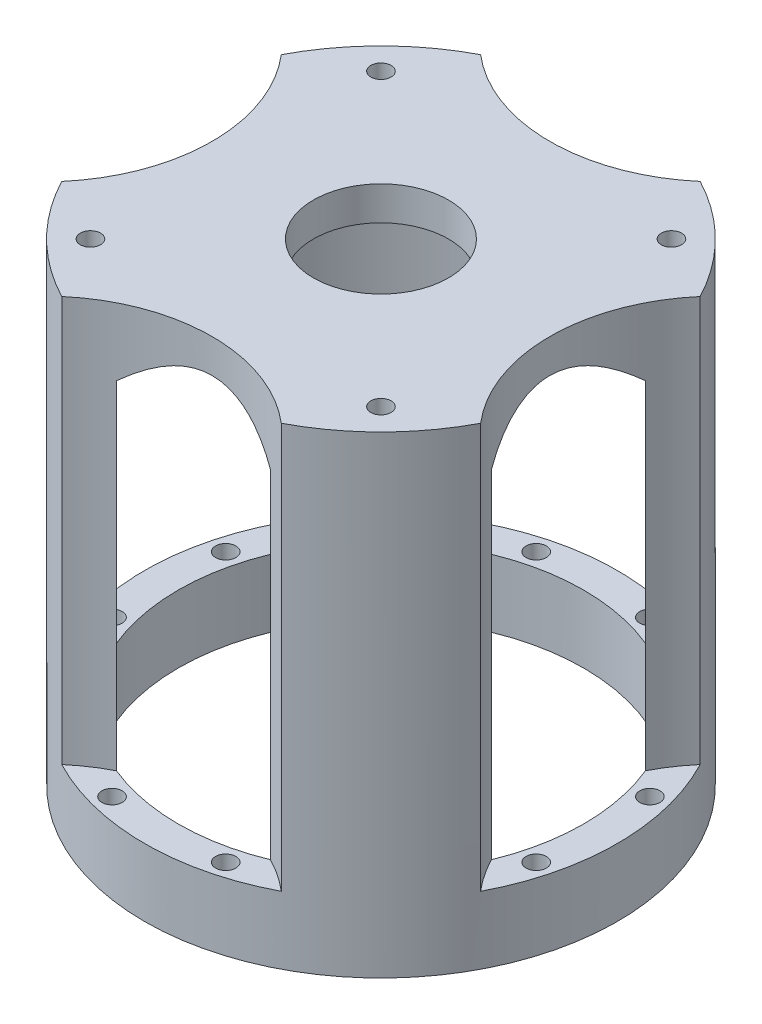
from build123d import *

# Parameters (mm, degrees)
SKETCH1_R           = 35
SKETCH1_R_2         = 30
SKETCH1_R_3         = 1.5
BOSS_EXTRUDE1_DEPTH = 65
SKETCH2_R           = 35
SKETCH2_R_2         = 1.5
SKETCH2_R_3         = 10
BOSS_EXTRUDE2_DEPTH = 5
SKETCH3_R           = 25
CUT_EXTRUDE1_DEPTH  = 60
CIRPATTERN1_COUNT   = 4
CHAMFER1_SIZE       = 5
SKETCH4_R           = 1.5
CUT_EXTRUDE2_DEPTH  = 4


with BuildPart() as part:
    # Sketch1 → Boss-Extrude1 (new body)
    with BuildSketch(Plane(origin=(0, 0, 0), x_dir=(1, 0, 0), z_dir=(0, 1, 0))):
        with Locations(Location((0, 0, 0), (0, 0, 270))):
            Circle(SKETCH1_R)
        with Locations(Location((0, 0, 0), (0, 0, 270))):
            Circle(SKETCH1_R_2, mode=Mode.SUBTRACT)
        with Locations(Location((-8.411618966, 31.392589354, 0), (0, 0, 270))):
            Circle(SKETCH1_R_3, mode=Mode.SUBTRACT)
        with Locations(Location((8.411618966, 31.392589354, 0), (0, 0, 270))):
            Circle(SKETCH1_R_3, mode=Mode.SUBTRACT)
        with Locations(Location((31.392589354, 8.411618966, 0), (0, 0, 270))):
            Circle(SKETCH1_R_3, mode=Mode.SUBTRACT)
        with Locations(Location((31.392589354, -8.411618966, 0), (0, 0, 270))):
            Circle(SKETCH1_R_3, mode=Mode.SUBTRACT)
        with Locations(Location((8.411618966, -31.392589354, 0), (0, 0, 270))):
            Circle(SKETCH1_R_3, mode=Mode.SUBTRACT)
        with Locations(Location((-8.411618966, -31.392589354, 0), (0, 0, 270))):
            Circle(SKETCH1_R_3, mode=Mode.SUBTRACT)
        with Locations(Location((-31.392589354, -8.411618966, 0), (0, 0, 270))):
            Circle(SKETCH1_R_3, mode=Mode.SUBTRACT)
        with Locations(Location((-31.392589354, 8.411618966, 0), (0, 0, 270))):
            Circle(SKETCH1_R_3, mode=Mode.SUBTRACT)
    extrude(amount=BOSS_EXTRUDE1_DEPTH)

    # Sketch2 → Boss-Extrude2 (add)
    with BuildSketch(Plane(origin=(0, 65, 0), x_dir=(1, 0, 0), z_dir=(0, 1, 0))):
        with Locations(Location((0, 0, 0), (0, 0, 270))):
            Circle(SKETCH2_R)
        with Locations(Location((-8.411618966, 31.392589354, 0), (0, 0, 270))):
            Circle(SKETCH2_R_2, mode=Mode.SUBTRACT)
        with Locations(Location((8.411618966, 31.392589354, 0), (0, 0, 270))):
            Circle(SKETCH2_R_2, mode=Mode.SUBTRACT)
        with Locations(Location((31.392589354, 8.411618966, 0), (0, 0, 270))):
            Circle(SKETCH2_R_2, mode=Mode.SUBTRACT)
        with Locations(Location((31.392589354, -8.411618966, 0), (0, 0, 270))):
            Circle(SKETCH2_R_2, mode=Mode.SUBTRACT)
        with Locations(Location((8.411618966, -31.392589354, 0), (0, 0, 270))):
            Circle(SKETCH2_R_2, mode=Mode.SUBTRACT)
        with Locations(Location((-8.411618966, -31.392589354, 0), (0, 0, 270))):
            Circle(SKETCH2_R_2, mode=Mode.SUBTRACT)
        with Locations(Location((-31.392589354, -8.411618966, 0), (0, 0, 270))):
            Circle(SKETCH2_R_2, mode=Mode.SUBTRACT)
        with Locations(Location((-31.392589354, 8.411618966, 0), (0, 0, 270))):
            Circle(SKETCH2_R_2, mode=Mode.SUBTRACT)
        with Locations(Location((0, 0, 0), (0, 0, 270))):
            Circle(SKETCH2_R_3, mode=Mode.SUBTRACT)
    extrude(amount=BOSS_EXTRUDE2_DEPTH)

    # Sketch3 → Cut-Extrude1 (cut)
    with BuildSketch(Plane(origin=(0, 70, 0), x_dir=(1, 0, 0), z_dir=(0, 1, 0))):
        with Locations((0, 50)):
            Circle(SKETCH3_R)
    cut_extrude1 = extrude(amount=-CUT_EXTRUDE1_DEPTH, mode=Mode.SUBTRACT)

    # CirPattern1: Cut-Extrude1 ×4 about axis
    cirpattern1_axis = Axis((0, 0, 0), (0, 1, 0))
    for i in range(1, CIRPATTERN1_COUNT):
        add(cut_extrude1.rotate(cirpattern1_axis, i * 360 / CIRPATTERN1_COUNT), mode=Mode.SUBTRACT)

    # Chamfer1
    chamfer1_edges = [part.edges().sort_by_distance(p)[0] for p in [
        (-21.213203436, 65, -21.213203436),
        (21.213203436, 65, 21.213203436),
        (21.213203436, 65, -21.213203436),
        (-21.213203436, 65, 21.213203436),
    ]]
    chamfer(chamfer1_edges, length=CHAMFER1_SIZE - 0.0001)  # a hair under: the kernel refuses the full size

    # Sketch4 → Cut-Extrude2 (cut)
    with BuildSketch(Plane(origin=(0, 70, 0), x_dir=(1, 0, 0), z_dir=(0, 1, 0))):
        with Locations(Location((-21.5, 21.5, 0), (0, 0, 270))):
            Circle(SKETCH4_R)
        with Locations(Location((21.5, 21.5, 0), (0, 0, 270))):
            Circle(SKETCH4_R)
        with Locations(Location((21.5, -21.5, 0), (0, 0, 270))):
            Circle(SKETCH4_R)
        with Locations(Location((-21.5, -21.5, 0), (0, 0, 270))):
            Circle(SKETCH4_R)
    extrude(amount=-CUT_EXTRUDE2_DEPTH, mode=Mode.SUBTRACT)


solid = part.part
